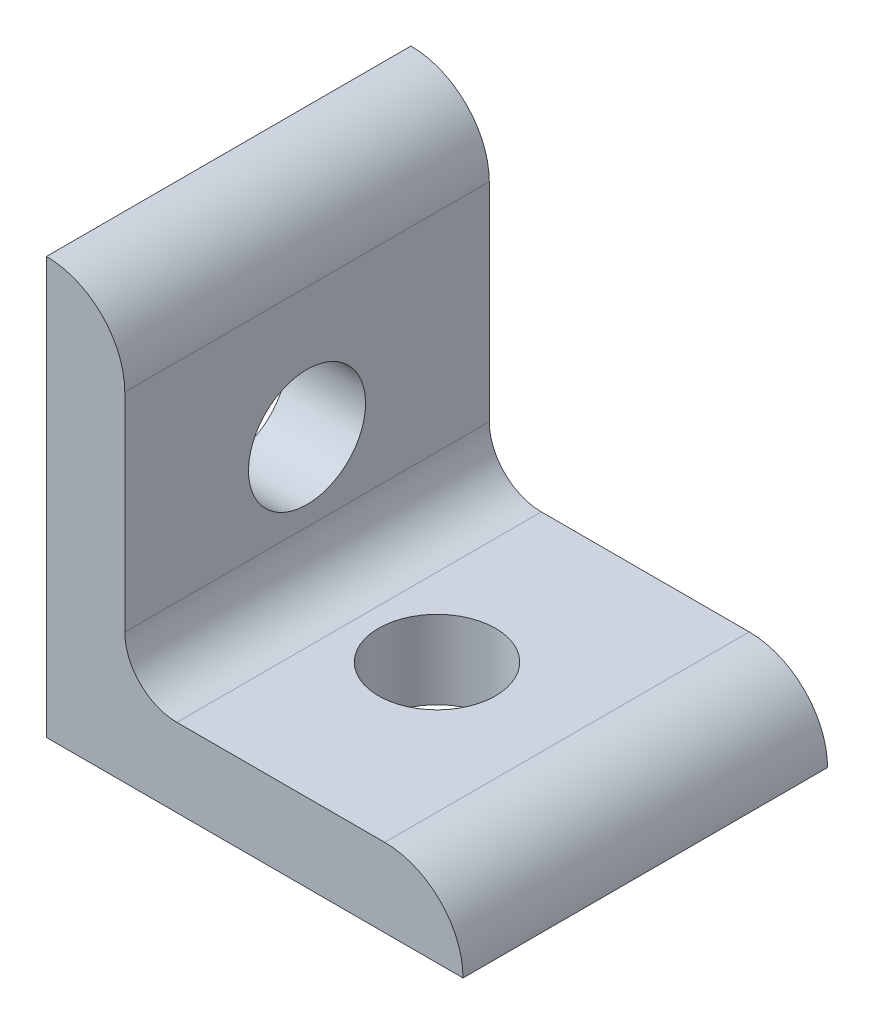
from build123d import *

# Parameters (mm, degrees)
BOSS_EXTRUDE1_DEPTH = 11.1125
SKETCH2_R           = 3.5687
CUT_EXTRUDE1_DEPTH  = 38.600633721
SKETCH3_R           = 3.5687
CUT_EXTRUDE2_DEPTH  = 38.600633721


with BuildPart() as part:
    # Sketch1 → Boss-Extrude1 (new, symmetric)
    with BuildSketch(Plane.XY):
        with BuildLine():
            Line((0, 0), (0, 25.4))
            ThreePointArc((0, 25.4), (3.376576302, 24.001376302), (4.7752, 20.6248))
            Line((4.7752, 20.6248), (4.7752, 7.9502))
            ThreePointArc((4.7752, 7.9502), (5.70513597, 5.70513597), (7.9502, 4.7752))
            Line((7.9502, 4.7752), (20.6248, 4.7752))
            ThreePointArc((20.6248, 4.7752), (24.001376302, 3.376576302), (25.4, 0))
            Line((25.4, 0), (0, 0))
        make_face()
    extrude(amount=BOSS_EXTRUDE1_DEPTH, both=True)

    # Sketch2 → Cut-Extrude1 (cut, through all)
    with BuildSketch(Plane(origin=(0, 0, 0), x_dir=(1, 0, 0), z_dir=(0, 1, 0))):
        with Locations((12.7, 0)):
            Circle(SKETCH2_R)
    extrude(amount=CUT_EXTRUDE1_DEPTH, mode=Mode.SUBTRACT)

    # Sketch3 → Cut-Extrude2 (cut, through all)
    with BuildSketch(Plane(origin=(0, 0, 0), x_dir=(0, 0, -1), z_dir=(1, 0, 0))):
        with Locations((0, 12.7)):
            Circle(SKETCH3_R)
    extrude(amount=CUT_EXTRUDE2_DEPTH, mode=Mode.SUBTRACT)


solid = part.part
